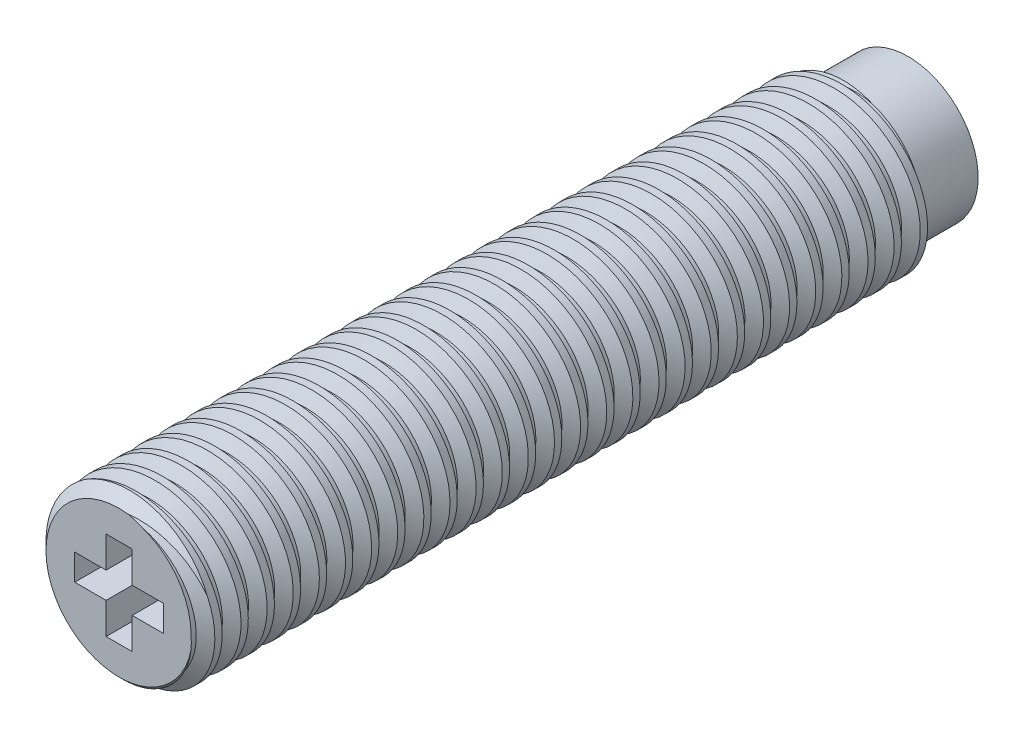
from build123d import *

# Parameters (mm, degrees)
SKETCH1_R           = 8
BOSS_EXTRUDE1_DEPTH = 75.5
CHAMFER1_SIZE       = 1
CUT_SWEEP2_PITCH    = 2.5
SKETCH5_W           = 1.3
SKETCH5_H           = 5.5
SKETCH6_W           = 8
SKETCH6_H           = 4
CUT_EXTRUDE1_DEPTH  = 8
CUT_EXTRUDE2_DEPTH  = 1.5
SKETCH8_W           = 2.5
SKETCH8_H           = 3
SKETCH8_H_2         = 2.5
SKETCH8_W_2         = 3
CUT_EXTRUDE3_DEPTH  = 11


with BuildPart() as part:
    # Sketch1 → Boss-Extrude1 (new body)
    with BuildSketch(Plane.XY):
        Circle(SKETCH1_R)
    extrude(amount=BOSS_EXTRUDE1_DEPTH)

    # Chamfer1
    chamfer1_edges = [part.edges().sort_by_distance(p)[0] for p in [
        (-8, 0, 75.5),
    ]]
    chamfer(chamfer1_edges, length=CHAMFER1_SIZE)

    # Cut-Sweep2: the profile of Sketch4 screwed along a right-hand helix of 29 turns, 10 arcs to a turn; built about Z, then put on its axis
    cut_sweep2_z = Axis((0, 0, 0), (0, 0, 1))
    cut_sweep2_corners = [(8.170091408, 0, 0), (8.170091408, 0, -2), (6.870091408, 0, -1.24944465), (6.870091408, 0, -0.75055535)]
    with BuildLine(mode=Mode.PRIVATE) as cut_sweep2_profile:
        Line(cut_sweep2_corners[0], cut_sweep2_corners[1])
        Line(cut_sweep2_corners[1], cut_sweep2_corners[2])
        Line(cut_sweep2_corners[2], cut_sweep2_corners[3])
        Line(cut_sweep2_corners[3], cut_sweep2_corners[0])
    cut_sweep2_cap = Face(cut_sweep2_profile.wire())
    cut_sweep2_turn_angles = [0, 18, 36, 54, 72, 90, 108, 126, 144, 162, 180, 198, 216, 234, 252, 270, 288, 306, 324, 342, 360]
    cut_sweep2_turn_weights = [1, 0.9510565162951535, 1, 0.9510565162951535, 1, 0.9510565162951535, 1, 0.9510565162951535, 1, 0.9510565162951535, 1, 0.9510565162951535, 1, 0.9510565162951535, 1, 0.9510565162951535, 1, 0.9510565162951535, 1, 0.9510565162951535, 1]
    cut_sweep2_turn_rails = [Edge.make_bspline([Vector(p[0], p[1], 0).rotate(cut_sweep2_z, cut_sweep2_turn_angles[k]) / cut_sweep2_turn_weights[k] + Vector(0, 0, p[2] + CUT_SWEEP2_PITCH * cut_sweep2_turn_angles[k] / 360) for k in range(21)], [0, 0, 0, 1, 1, 2, 2, 3, 3, 4, 4, 5, 5, 6, 6, 7, 7, 8, 8, 9, 9, 10, 10, 10], 2, cut_sweep2_turn_weights) for p in cut_sweep2_corners]
    cut_sweep2_turn_sides = [Face.make_surface_from_curves(cut_sweep2_turn_rails[p[0]], cut_sweep2_turn_rails[p[1]]) for p in [(0, 1), (1, 2), (2, 3), (3, 0)]]
    cut_sweep2 = Plane(origin=(0, 0, 75.5), x_dir=(-1, 0, 0), z_dir=(0, 0, -1)) * Solid(Shell([*[p.moved(Location((0, 0, CUT_SWEEP2_PITCH * i))) for i in range(29) for p in cut_sweep2_turn_sides], cut_sweep2_cap, cut_sweep2_cap.rotate(cut_sweep2_z, 10440).moved(Location((0, 0, CUT_SWEEP2_PITCH * 10440 / 360)))]))
    add(cut_sweep2, mode=Mode.SUBTRACT)

    # Cut-Sweep3: sweep along a curve in space
    with BuildLine() as cut_sweep3_path:
        ThreePointArc((8, 0, 0), (5.656854249, 5.656854249, 0), (0, 8, 0))
        ThreePointArc((0, 8, 0), (-5.656854249, 5.656854249, 0), (-8, 0, 0))
        ThreePointArc((-8, 0, 0), (-5.656854249, -5.656854249, 0), (0, -8, 0))
        ThreePointArc((0, -8, 0), (5.656854249, -5.656854249, 0), (8, 0, 0))
    # Sketch5 → Cut-Sweep3 (sweep, cut)
    with BuildSketch(Plane(origin=(0, 0, 0), x_dir=(1, 0, 0), z_dir=(0, 1, 0))):
        with Locations((7.35, -2.75)):
            Rectangle(SKETCH5_W, SKETCH5_H)
    sweep(path=cut_sweep3_path.line, mode=Mode.SUBTRACT)

    # Sketch6 → Cut-Extrude1 (cut)
    with BuildSketch(Plane.XY):
        Rectangle(SKETCH6_W, SKETCH6_H)
    extrude(amount=CUT_EXTRUDE1_DEPTH, mode=Mode.SUBTRACT)

    # Sketch7 → Cut-Extrude2 (cut)
    with BuildSketch(Plane.XY):
        with BuildLine():
            Line((0.47328415, 5.248184858), (0.802310592, 4.933681653))
            add(Edge.make_bspline(
                [(0.802310592, 4.933681653), (0.830221296, 4.962541367), (0.884739643, 5.01891343), (0.972589218, 5.093545073), (1.063949578, 5.15574045), (1.157043488, 5.208121), (1.253545439, 5.24775062), (1.352339605, 5.276629391), (1.454056816, 5.294235686), (1.522895112, 5.296250158), (1.557518926, 5.297263383)],
                knots=[0, 0, 0, 0, 1.115251505, 2.178435587, 3.19620269, 4.182487026, 5.141301733, 6.088180966, 7.038406374, 8, 8, 8, 8], degree=3))
            add(Edge.make_bspline(
                [(1.557518926, 5.297263383), (1.586434018, 5.2964629), (1.643494767, 5.294883234), (1.727274899, 5.283302727), (1.807414925, 5.263609571), (1.884189177, 5.236468753), (1.957371744, 5.201349975), (2.027116062, 5.158280419), (2.093250179, 5.107649063), (2.154900502, 5.049717876), (2.211296051, 4.986423702), (2.261125109, 4.918888969), (2.302864938, 4.847268395), (2.337120137, 4.772287301), (2.363803613, 4.693598638), (2.382858967, 4.611255382), (2.393880075, 4.525159468), (2.395525049, 4.466632107), (2.396361073, 4.436886781)],
                knots=[0, 0, 0, 0, 1.035432265, 2.043311493, 3.022114605, 3.98653278, 4.95457646, 5.923598177, 6.917315552, 7.932509744, 8.948865224, 9.949768934, 10.933144597, 11.912367597, 12.897413939, 13.903909035, 14.934704909, 16, 16, 16, 16], degree=3))
            add(Edge.make_bspline(
                [(2.396361073, 4.436886781), (2.39612014, 4.416009429), (2.395645257, 4.374859741), (2.39044682, 4.313987931), (2.382076112, 4.254927885), (2.369961622, 4.197769062), (2.354812334, 4.142461929), (2.337038769, 4.088529353), (2.314742094, 4.036716562), (2.289992448, 3.986421783), (2.261208895, 3.939017373), (2.230174915, 3.893813333), (2.19652363, 3.85103125), (2.160037079, 3.810846018), (2.12020176, 3.773885642), (2.078047268, 3.73903868), (2.032862515, 3.707177469), (1.985586103, 3.677502418), (1.935809623, 3.651723448), (1.884883626, 3.628372681), (1.832035973, 3.609408387), (1.777910114, 3.594121436), (1.722699478, 3.581122167), (1.665864051, 3.573118118), (1.607896527, 3.567056745), (1.56872021, 3.566682491), (1.549005304, 3.566494153)],
                knots=[0, 0, 0, 0, 1.103660481, 2.175337485, 3.227646561, 4.255952547, 5.262355991, 6.258840057, 7.255597736, 8.242457506, 9.22035537, 10.185017736, 11.140346927, 12.096287581, 13.051739095, 14.01125915, 14.986044842, 15.97314143, 16.960198552, 17.947847494, 18.933482797, 19.925264591, 20.920966487, 21.929612487, 22.958107872, 24, 24, 24, 24], degree=3))
            add(Edge.make_bspline(
                [(1.549005304, 3.566494153), (1.515565434, 3.567461411), (1.449864787, 3.569361822), (1.35343964, 3.58422277), (1.261556081, 3.608668189), (1.188141558, 3.637536807), (1.130623217, 3.666044943), (1.086835355, 3.692413564), (1.041555293, 3.721909763), (0.995535094, 3.755646756), (0.948257122, 3.793219688), (0.900555942, 3.835451474), (0.851210395, 3.880951483), (0.818884617, 3.913425734), (0.802310592, 3.930075883)],
                knots=[0, 0, 0, 0, 1.404581149, 2.759636711, 4.088442092, 5.392261763, 6.066678138, 6.783632037, 7.538459478, 8.336747902, 9.180226004, 10.074962426, 11.012997595, 12, 12, 12, 12], degree=3))
            Line((0.802310592, 3.930075883), (0.483300176, 3.595039826))
            add(Edge.make_bspline(
                [(0.483300176, 3.595039826), (0.505724891, 3.573389467), (0.549493139, 3.531132597), (0.615516327, 3.471131786), (0.681456422, 3.417214386), (0.745720448, 3.367423434), (0.809361119, 3.32320946), (0.872371684, 3.284528307), (0.934038836, 3.250401674), (0.995643115, 3.221405089), (1.057567852, 3.196783976), (1.12128113, 3.175586814), (1.186977726, 3.157654778), (1.255058884, 3.14318598), (1.324889585, 3.131583957), (1.397123352, 3.123752658), (1.471302187, 3.118487937), (1.521618839, 3.118014858), (1.547002099, 3.117776204)],
                knots=[0, 0, 0, 0, 1.244526981, 2.429050516, 3.560637417, 4.644440555, 5.67424972, 6.652764056, 7.595344123, 8.486817594, 9.369275933, 10.254498637, 11.166417451, 12.086725134, 13.032340136, 13.991389299, 14.986715468, 16, 16, 16, 16], degree=3))
            add(Edge.make_bspline(
                [(1.547002099, 3.117776204), (1.593628001, 3.118964791), (1.684861933, 3.121290526), (1.81856288, 3.138522647), (1.945575192, 3.167411993), (2.066207864, 3.208269498), (2.180422538, 3.260463045), (2.288189995, 3.324449883), (2.389336538, 3.400060009), (2.483045102, 3.486407199), (2.567808958, 3.581770421), (2.64273039, 3.68416436), (2.704705401, 3.794092244), (2.756164589, 3.909930087), (2.796404997, 4.032206502), (2.824727422, 4.161053755), (2.842193655, 4.296347437), (2.844104486, 4.38875614), (2.845079022, 4.435885178)],
                knots=[0, 0, 0, 0, 1.078019885, 2.10938526, 3.111377082, 4.085535484, 5.04941344, 6.010039228, 6.978205633, 7.964457913, 8.951525778, 9.924444315, 10.892603023, 11.863865945, 12.85144698, 13.863884204, 14.910567087, 16, 16, 16, 16], degree=3))
            add(Edge.make_bspline(
                [(2.845079022, 4.435885178), (2.84466723, 4.466622335), (2.843851159, 4.527535867), (2.835274183, 4.617266434), (2.823317379, 4.704737687), (2.804348996, 4.789041384), (2.781484481, 4.871313252), (2.753049453, 4.95065909), (2.719089327, 5.027306948), (2.680698717, 5.101385137), (2.637267803, 5.172408368), (2.588750705, 5.239766438), (2.536396442, 5.303979338), (2.478947025, 5.364195167), (2.417237271, 5.42094263), (2.350988567, 5.473914202), (2.280599365, 5.523869556), (2.205879148, 5.569520463), (2.128279532, 5.610814135), (2.04877925, 5.647236918), (1.967573627, 5.677677976), (1.885006007, 5.702927711), (1.800727543, 5.721774853), (1.715339793, 5.736041532), (1.62811621, 5.744016696), (1.56955313, 5.745322281), (1.539990881, 5.745981332)],
                knots=[0, 0, 0, 0, 1.071919942, 2.124283339, 3.142214191, 4.149696895, 5.136002878, 6.119640489, 7.086990633, 8.058538607, 9.028339693, 9.988281803, 10.952401235, 11.916291999, 12.888973767, 13.874849856, 14.873389453, 15.898127285, 16.927174885, 17.938320013, 18.946391617, 19.950418109, 20.947802303, 21.956882652, 22.968648068, 24, 24, 24, 24], degree=3))
            add(Edge.make_bspline(
                [(1.539990881, 5.745981332), (1.51477125, 5.745603548), (1.464594204, 5.744851907), (1.389872162, 5.738586164), (1.315747712, 5.728745878), (1.242486242, 5.713898981), (1.169563711, 5.696273839), (1.097938403, 5.673196146), (1.026480391, 5.647471709), (0.956310386, 5.616723396), (0.887330442, 5.583158836), (0.821156523, 5.545078623), (0.756677574, 5.504826171), (0.695322411, 5.460019165), (0.635941719, 5.412282837), (0.578846005, 5.361394471), (0.524536317, 5.306505608), (0.490454573, 5.267723386), (0.47328415, 5.248184858)],
                knots=[0, 0, 0, 0, 0.996412454, 1.982464992, 2.961075852, 3.949442424, 4.934965278, 5.923860011, 6.921385422, 7.934793307, 8.949617135, 9.951082467, 10.950285876, 11.951772932, 12.951063433, 13.960125323, 14.972308753, 16, 16, 16, 16], degree=3))
        make_face()
        Polygon((0.264950817, 5.681878768), (-0.198290369, 5.681878768), (-0.568382517, 4.085825082), (-0.992561203, 5.681878768), (-1.428759119, 5.681878768), (-1.850433799, 4.085825082), (-2.219524344, 5.681878768), (-2.683767132, 5.681878768), (-2.105341651, 3.181878768), (-1.636591651, 3.181878768), (-1.209408158, 4.797964505), (-0.779720658, 3.181878768), (-0.314476267, 3.181878768), align=None)
    extrude(amount=CUT_EXTRUDE2_DEPTH, mode=Mode.SUBTRACT)

    # Sketch8 → Cut-Extrude3 (cut)
    with BuildSketch(Plane.XY.offset(75.5)):
        with Locations((0, 2.75)):
            Rectangle(SKETCH8_W, SKETCH8_H)
        Rectangle(SKETCH8_W, SKETCH8_H_2)
        with Locations((-2.75, 0)):
            Rectangle(SKETCH8_W_2, SKETCH8_H_2)
        with Locations((2.75, 0)):
            Rectangle(SKETCH8_W_2, SKETCH8_H_2)
        with Locations((0, -2.75)):
            Rectangle(SKETCH8_W, SKETCH8_H)
    extrude(amount=-CUT_EXTRUDE3_DEPTH, mode=Mode.SUBTRACT)


solid = part.part
